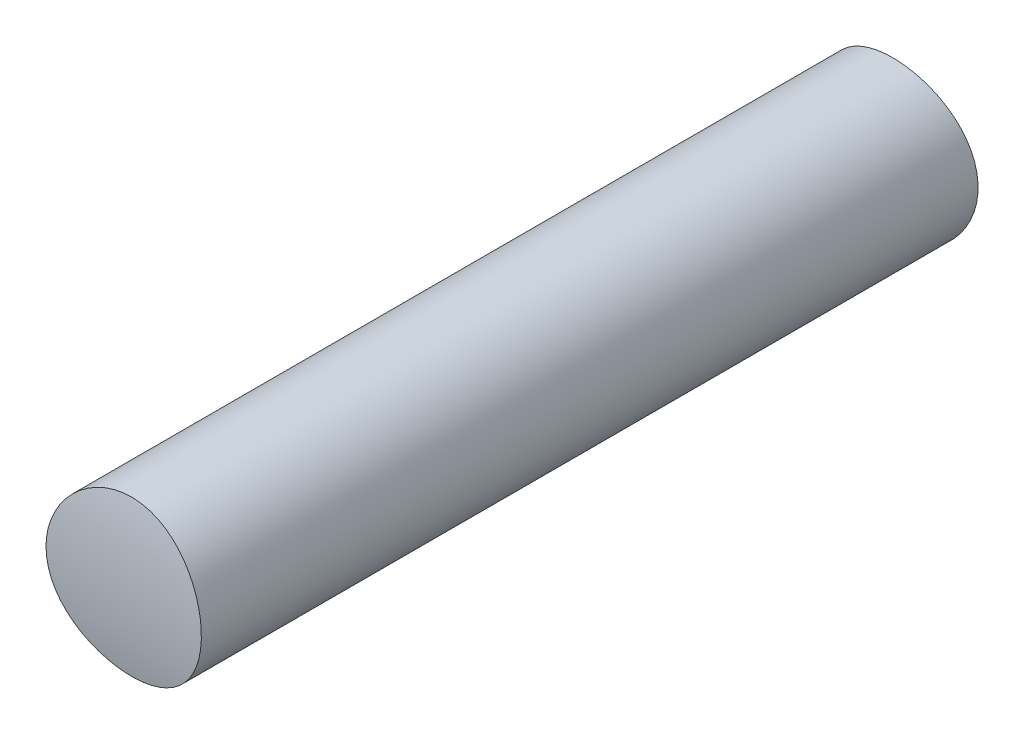
from build123d import *

# Parameters (mm, degrees)
SKETCH1_R           = 7.5
BOSS_EXTRUDE1_DEPTH = 37.5
CUT_EXTRUDE2_START  = -9
CUT_EXTRUDE2_DEPTH  = 17


with BuildPart() as part:
    # Sketch1 → Boss-Extrude1 (new, symmetric)
    with BuildSketch(Plane.XY):
        Circle(SKETCH1_R)
    extrude(amount=BOSS_EXTRUDE1_DEPTH, both=True)

    # Cut-Extrude2: read off the stored shape, not the designer's step
    # Cut-Extrude2 outline → Cut-Extrude2 (cut)
    with BuildSketch(Plane(origin=(0, 0, 0), x_dir=(0, 0, -1), z_dir=(1, 0, 0)).offset(CUT_EXTRUDE2_START)):
        with BuildLine():
            ThreePointArc((37.5, 0), (37.310078961, -3.769351124), (36.742239579, -7.50052203))
            Line((36.742239579, -7.50052203), (36.640276673, -8))
            Line((36.640276673, -8), (37.5, -8))
            Line((37.5, -8), (37.5, 0))
        make_face()
        with BuildLine():
            ThreePointArc((36.742239579, 7.50052203), (37.310078961, 3.769351124), (37.5, 0))
            Line((37.5, 0), (37.5, 8))
            Line((37.5, 8), (36.640276673, 8))
            Line((36.640276673, 8), (36.742239579, 7.50052203))
        make_face()
        with BuildLine():
            Line((-37.5, -8), (-36.640276673, -8))
            Line((-36.640276673, -8), (-36.742239584, -7.500522004))
            ThreePointArc((-36.742239584, -7.500522004), (-37.310078963, -3.769351111), (-37.5, 0))
            Line((-37.5, 0), (-37.5, -8))
        make_face()
        with BuildLine():
            Line((-36.742239545, 7.500522195), (-36.64027667, 8))
            Line((-36.64027667, 8), (-37.5, 8))
            Line((-37.5, 8), (-37.5, 0))
            ThreePointArc((-37.5, 0), (-37.310078953, 3.769351208), (-36.742239545, 7.500522195))
        make_face()
    extrude(amount=CUT_EXTRUDE2_DEPTH, mode=Mode.SUBTRACT)


solid = part.part
